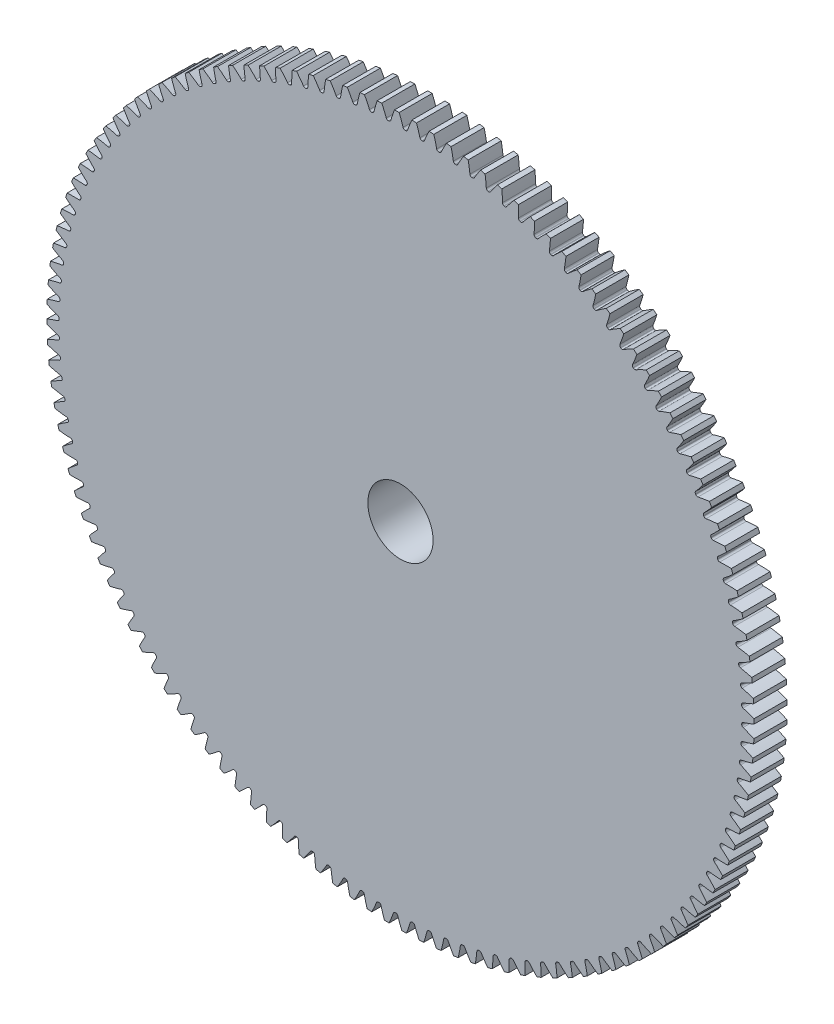
from build123d import *

# Parameters (mm, degrees)
SKETCH3_R         = 51.59375
GEARBODY_DEPTH    = 4.825999939
TOOTHCUT_DEPTH    = 74.124006684
CIRPATTERN1_COUNT = 128
HUB1DIA_R         = 23.875999939
HUB1_DEPTH        = 12.7
BOREDIA_R         = 4.7625
BORE_DEPTH        = 12700


with BuildPart() as part:
    # Sketch3 → gearBody (new body)
    with BuildSketch(Plane.XY):
        Circle(SKETCH3_R)
    extrude(amount=GEARBODY_DEPTH)

    # Sketch2 → toothCut (cut, through all)
    with BuildSketch(Plane.XY):
        with BuildLine():
            ThreePointArc((49.791128573, -0.74488004), (49.791669175, -0.707821777), (49.792182195, -0.670763122))
            ThreePointArc((49.792182195, -0.670763122), (49.85206095, -0.493754461), (50.00423691, -0.385310888))
            ThreePointArc((50.00423691, -0.385310888), (55.775785838, 2.567286461), (60.26561802, 7.243825258))
            ThreePointArc((60.26561802, 7.243825258), (60.693272312, -0.862795335), (60.035355364, -8.953983808))
            ThreePointArc((60.035355364, -8.953983808), (55.680270843, -4.151708623), (49.994983451, -1.036244707))
            ThreePointArc((49.994983451, -1.036244707), (49.845951557, -0.923519263), (49.791128573, -0.74488004))
        make_face()
    toothcut = extrude(amount=TOOTHCUT_DEPTH, mode=Mode.SUBTRACT)

    # CirPattern1: toothCut ×128 about axis
    cirpattern1_axis = Axis((0, 0, 0), (0, 0, 1))
    for i in range(1, CIRPATTERN1_COUNT):
        add(toothcut.rotate(cirpattern1_axis, i * 360 / CIRPATTERN1_COUNT), mode=Mode.SUBTRACT)

    # hub1Dia → hub1 (add)
    with BuildSketch(Plane(origin=(0, 0, 0), x_dir=(-1, 0, 0), z_dir=(0, 0, -1))):
        with Locations(Location((0, 0, 0), (0, 0, 180))):
            Circle(HUB1DIA_R)
    extrude(amount=HUB1_DEPTH)

    # boreDia → bore (cut, symmetric)
    with BuildSketch(Plane.XY):
        Circle(BOREDIA_R)
    extrude(amount=BORE_DEPTH, both=True, mode=Mode.SUBTRACT)


solid = part.part
